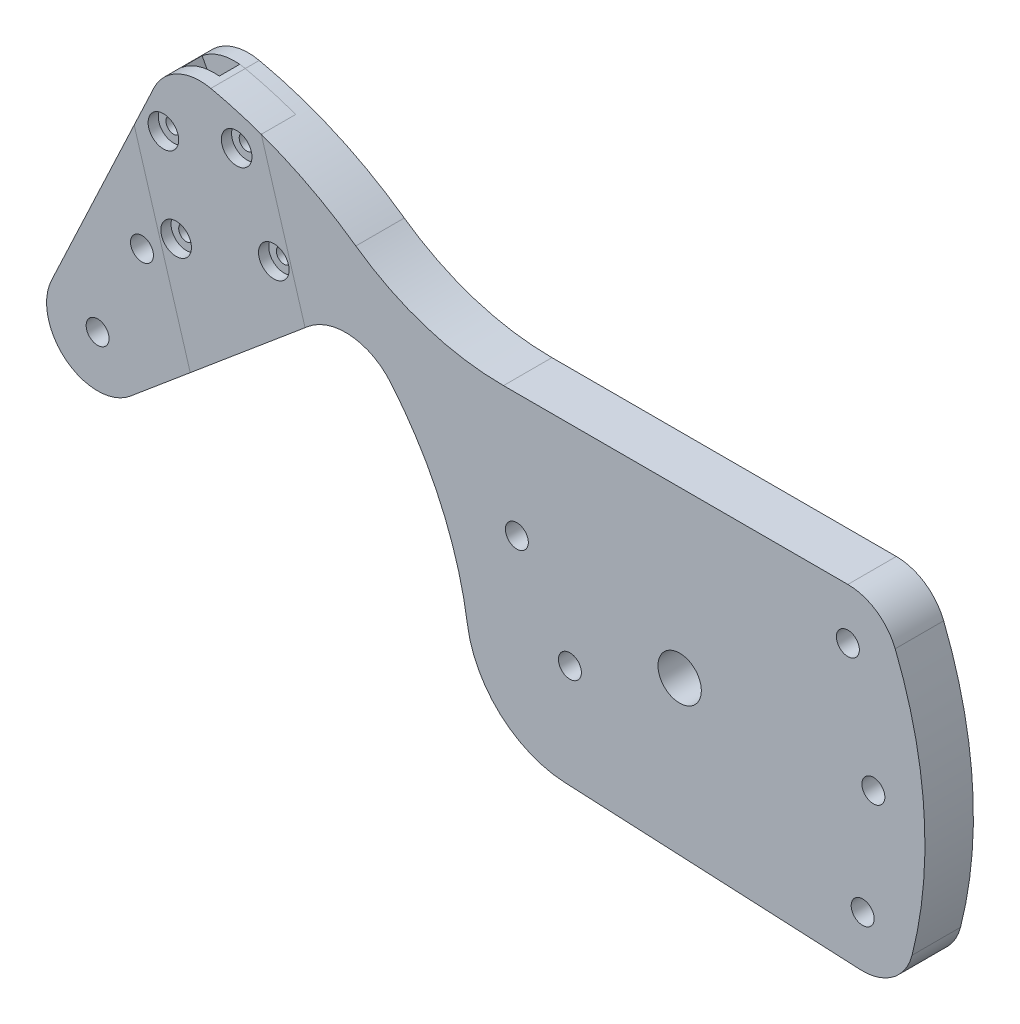
from build123d import *

# Parameters (mm, degrees)
SKETCH1_R              = 2.25
SKETCH1_R_2            = 4.25
BOSS_EXTRUDE1_DEPTH    = 4.75
CUT_EXTRUDE1_DEPTH     = 2
SKETCH4_R              = 1.5
CUT_EXTRUDE2_DEPTH     = 136.849086626
SKETCH5_R              = 3
CUT_EXTRUDE3_DEPTH     = 2
SPLIT3_SURFACE_1_BACK  = 193.818
SPLIT3_SURFACE_1_DEPTH = 387.636
SPLIT3_SURFACE_2_BACK  = 193.818
SPLIT3_SURFACE_2_DEPTH = 387.636


with BuildPart() as part:
    # Sketch1 → Boss-Extrude1 (new, symmetric)
    with BuildSketch(Plane.XY):
        with BuildLine():
            Line((-22.500230832, -28.983987123), (35.398437983, -31.788291003))
            ThreePointArc((35.398437983, -31.788291003), (41.825152283, -29.842482755), (45.572267137, -24.270413418))
            ThreePointArc((45.572267137, -24.270413418), (47.922199842, 1.185089324), (42.266415188, 26.115330067))
            ThreePointArc((42.266415188, 26.115330067), (38.587871094, 30.681102), (32.982217728, 32.4))
            Line((32.982217728, 32.4), (-34.53815208, 32.4))
            ThreePointArc((-34.53815208, 32.4), (-49.730929753, 34.764094355), (-63.487021029, 41.632819737))
            ThreePointArc((-63.487021029, 41.632819737), (-77.067258547, 49.344582351), (-91.918742124, 54.174444589))
            ThreePointArc((-91.918742124, 54.174444589), (-98.466295495, 53.366674665), (-103.085929893, 48.656905518))
            Line((-103.085929893, 48.656905518), (-123.167077545, 5.955614534))
            ThreePointArc((-123.167077545, 5.955614534), (-120.218280198, -6.2236308), (-107.689906175, -5.960444431))
            Line((-107.689906175, -5.960444431), (-72.864818345, 23.261273923))
            ThreePointArc((-72.864818345, 23.261273923), (-64.470178387, 25.908093735), (-56.662687309, 21.843771132))
            ThreePointArc((-56.662687309, 21.843771132), (-46.809939593, 6.135423294), (-41.608278072, -11.662653759))
            ThreePointArc((-41.608278072, -11.662653759), (-35.156858245, -23.745961099), (-22.500230832, -28.983987123))
        make_face()
        with Locations((35.882217728, -21.8)):
            Circle(SKETCH1_R, mode=Mode.SUBTRACT)
        with Locations((-21.517782272, -8.7)):
            Circle(SKETCH1_R, mode=Mode.SUBTRACT)
        Circle(SKETCH1_R_2, mode=Mode.SUBTRACT)
        with Locations((-31.917782272, 8.2)):
            Circle(SKETCH1_R, mode=Mode.SUBTRACT)
        with Locations((37.982217728, -0.1)):
            Circle(SKETCH1_R, mode=Mode.SUBTRACT)
        with Locations((32.982217728, 22.4)):
            Circle(SKETCH1_R, mode=Mode.SUBTRACT)
        with Locations((-105.417782272, 20.2)):
            Circle(SKETCH1_R, mode=Mode.SUBTRACT)
        with Locations((-114.117782272, 1.7)):
            Circle(SKETCH1_R, mode=Mode.SUBTRACT)
    extrude(amount=BOSS_EXTRUDE1_DEPTH, both=True)

    # Sketch2 → Cut-Extrude1 (cut, symmetric)
    with BuildSketch(Plane.XY):
        with BuildLine():
            Line((-78.227129447, 18.761760655), (-92.084556702, 44.987885053))
            Line((-92.084556702, 44.987885053), (-93.002217677, 54.347646176))
            ThreePointArc((-93.002217677, 54.347646176), (-96.914482214, 53.978242129), (-100.382341665, 52.129939126))
            Line((-100.382341665, 52.129939126), (-95.988712538, 43.814696915))
            Line((-95.988712538, 43.814696915), (-92.369017313, 6.895307763))
            Line((-92.369017313, 6.895307763), (-78.227129447, 18.761760655))
        make_face()
    extrude(amount=CUT_EXTRUDE1_DEPTH, both=True, mode=Mode.SUBTRACT)

    # Sketch4 → Cut-Extrude2 (cut, through all)
    with BuildSketch(Plane.XY.offset(4.75)):
        with Locations((-98.721244854, 25.242626445)):
            Circle(SKETCH4_R)
        with Locations((-101.219347979, 42.242905289)):
            Circle(SKETCH4_R)
        with Locations((-86.853921262, 46.55967668)):
            Circle(SKETCH4_R)
        with Locations((-79.567342565, 30.998321633)):
            Circle(SKETCH4_R)
    extrude(amount=-CUT_EXTRUDE2_DEPTH, mode=Mode.SUBTRACT)

    # Sketch5 → Cut-Extrude3 (cut)
    with BuildSketch(Plane.XY.offset(4.75)):
        with Locations((-101.219347979, 42.242905289)):
            Circle(SKETCH5_R)
        with Locations((-86.853921262, 46.55967668)):
            Circle(SKETCH5_R)
        with Locations((-79.567342565, 30.998321633)):
            Circle(SKETCH5_R)
        with Locations((-98.721244854, 25.242626445)):
            Circle(SKETCH5_R)
    extrude(amount=-CUT_EXTRUDE3_DEPTH, mode=Mode.SUBTRACT)


with BuildPart() as body_2:
    # Split3: the piece behind the surface
    add(part.part)
    # Split3 surface: a surface, the sketch's curves swept straight by 387.636 mm
    with BuildLine(Plane(origin=(-20.02556284, 66.641415389, 0), x_dir=(0.9576951144500195, 0.2877847594271872, 0), z_dir=(-0.2877847594271872, 0.9576951144500195, 0)).offset(-SPLIT3_SURFACE_1_BACK), mode=Mode.PRIVATE) as split3_surface_1_path:
        Line((-63.780410711, -4.75), (-63.780410711, 2))
        Line((-63.780410711, 2), (-90.780410711, 2))
        Line((-90.780410711, 2), (-90.780410711, -4.75))
    split3_surface_1 = Shell.extrude(split3_surface_1_path.wire(), (-0.287784759 * SPLIT3_SURFACE_1_DEPTH, 0.957695114 * SPLIT3_SURFACE_1_DEPTH, 0 * SPLIT3_SURFACE_1_DEPTH))
    split(bisect_by=split3_surface_1, keep=Keep.BOTTOM)


with BuildPart() as part_1:
    add(part.part)

    # Split3: split by a surface, the side it looks to stays
    # Split3 surface: a surface, the sketch's curves swept straight by 387.636 mm
    with BuildLine(Plane(origin=(-20.02556284, 66.641415389, 0), x_dir=(0.9576951144500195, 0.2877847594271872, 0), z_dir=(-0.2877847594271872, 0.9576951144500195, 0)).offset(-SPLIT3_SURFACE_2_BACK), mode=Mode.PRIVATE) as split3_surface_2_path:
        Line((-63.780410711, -4.75), (-63.780410711, 2))
        Line((-63.780410711, 2), (-90.780410711, 2))
        Line((-90.780410711, 2), (-90.780410711, -4.75))
    split3_surface_2 = Shell.extrude(split3_surface_2_path.wire(), (-0.287784759 * SPLIT3_SURFACE_2_DEPTH, 0.957695114 * SPLIT3_SURFACE_2_DEPTH, 0 * SPLIT3_SURFACE_2_DEPTH))
    split(bisect_by=split3_surface_2, keep=Keep.TOP)


solid = Compound([body_2.part, part_1.part])
